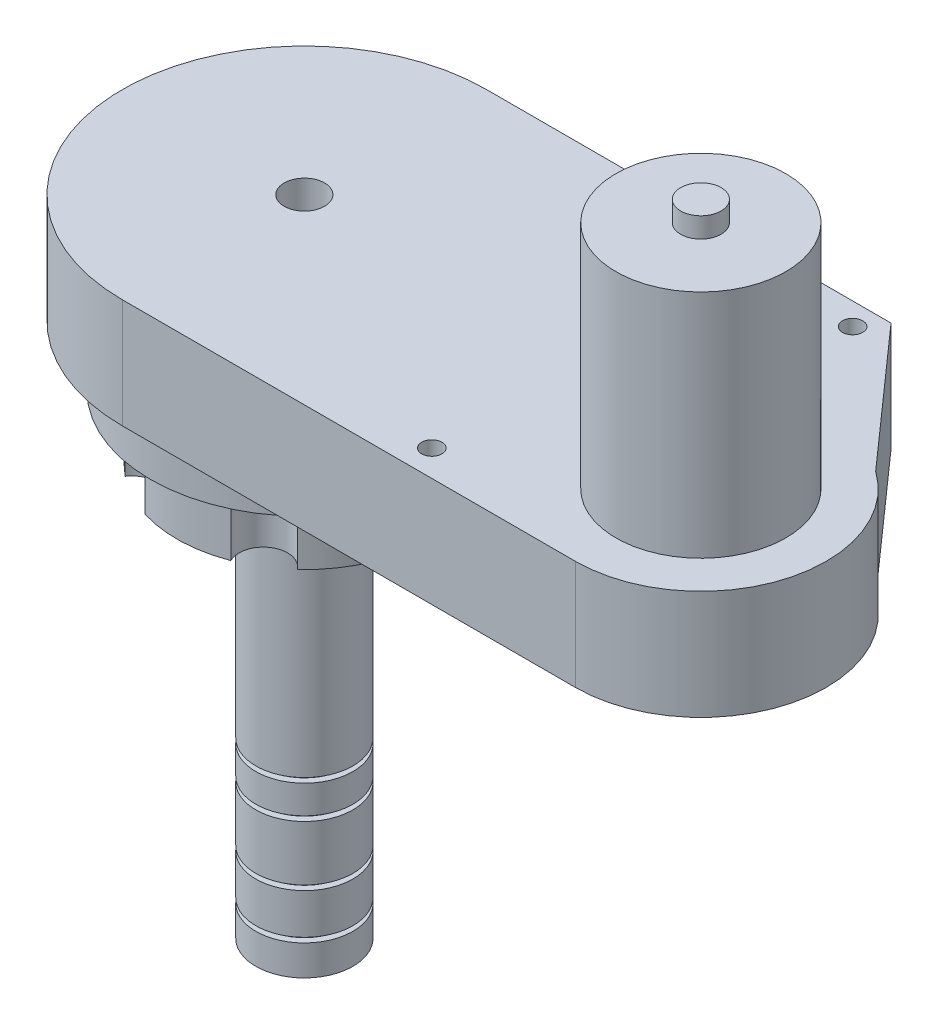
from build123d import *

# Parameters (mm, degrees)
GEAR_START                  = 1.977607415
GEAR_BOX_LEFT_OUTLINE_R     = 2.5
GEAR_BOX_LEFT_OUTLINE_R_2   = 5
GEAR_BOX_LEFT_DEPTH         = 27
GEAR_START_2                = -13.022392585
GEAR_BOX_LEFT_2_OUTLINE_R   = 38
GEAR_BOX_LEFT_2_OUTLINE_R_2 = 5
GEAR_BOX_LEFT_2_DEPTH       = 15
GEAR_START_3                = -29.022392585
GEAR_BOX_LEFT_3_DEPTH       = 16
GEAR_START_4                = 28.977607415
GEAR_BOX_LEFT_4_OUTLINE_R   = 21
GEAR_BOX_LEFT_4_DEPTH       = 57
GEAR_START_5                = 85.977607415
GEAR_BOX_LEFT_5_OUTLINE_R   = 5
GEAR_BOX_LEFT_5_DEPTH       = 5
SKETCH1_R                   = 23.5
BOSS_EXTRUDE1_DEPTH         = 16
SKETCH2_R                   = 12
BOSS_EXTRUDE2_DEPTH         = 101.2
SKETCH3_R                   = 12
SKETCH3_R_2                 = 10.4
CUT_EXTRUDE1_DEPTH          = 1.2
SKETCH4_R                   = 12
SKETCH4_R_2                 = 10.4
CUT_EXTRUDE2_DEPTH          = 1.2
SKETCH7_R                   = 12
SKETCH7_R_2                 = 10.4
CUT_EXTRUDE4_DEPTH          = 1.2
SKETCH8_R                   = 12
SKETCH8_R_2                 = 10.4
CUT_EXTRUDE5_DEPTH          = 1.2
SKETCH26_R                  = 24.974470238
SKETCH26_R_2                = 12
CUT_EXTRUDE16_DEPTH         = 16


# Read off the part's stored shape, not the designer's step: Gear Box_Left
with BuildPart() as part:
    # Gear Box_Left outline → Gear Box_Left (new body)
    with BuildSketch(Plane(origin=(0, 0, 0), x_dir=(1, 0, 0), z_dir=(0, 1, 0)).offset(GEAR_START)):
        with BuildLine():
            Line((-6.41204983, -47.039994013), (105.58795017, -47.039994013))
            ThreePointArc((105.58795017, -47.039994013), (135.138154019, -25.409383135), (123.450360395, 9.296428405))
            Line((123.450360395, 9.296428405), (93.58795017, 42.960005987))
            Line((93.58795017, 42.960005987), (-6.41204983, 42.960005987))
            ThreePointArc((-6.41204983, 42.960005987), (-51.41204983, -2.039994013), (-6.41204983, -47.039994013))
        make_face()
        with Locations((63.58795017, -40.539994013)):
            Circle(GEAR_BOX_LEFT_OUTLINE_R, mode=Mode.SUBTRACT)
        with Locations((89.58795017, 37.460005987)):
            Circle(GEAR_BOX_LEFT_OUTLINE_R, mode=Mode.SUBTRACT)
        with Locations((-6.41204983, -2.039994013)):
            Circle(GEAR_BOX_LEFT_OUTLINE_R_2, mode=Mode.SUBTRACT)
    extrude(amount=GEAR_BOX_LEFT_DEPTH)

    # Gear Box_Left 2 outline → Gear Box_Left 2 (add)
    with BuildSketch(Plane(origin=(0, 0, 0), x_dir=(1, 0, 0), z_dir=(0, 1, 0)).offset(GEAR_START_2)):
        with Locations((-6.41204983, -2.039994013)):
            Circle(GEAR_BOX_LEFT_2_OUTLINE_R)
        with Locations((-6.41204983, -2.039994013)):
            Circle(GEAR_BOX_LEFT_2_OUTLINE_R_2, mode=Mode.SUBTRACT)
    extrude(amount=GEAR_BOX_LEFT_2_DEPTH)

    # Gear Box_Left 3 outline → Gear Box_Left 3 (add)
    with BuildSketch(Plane(origin=(0, 0, 0), x_dir=(1, 0, 0), z_dir=(0, 1, 0)).offset(GEAR_START_3)):
        with BuildLine():
            ThreePointArc((14.98628711, -25.156247521), (21.36455001, -16.896322675), (24.694074697, -7.005778634))
            ThreePointArc((24.694074697, -7.005778634), (19.074516465, -1.21238391), (24.306381418, 4.933382621))
            ThreePointArc((24.306381418, 4.933382621), (20.342208118, 14.587082747), (13.441508065, 22.41580773))
            ThreePointArc((13.441508065, 22.41580773), (5.614501944, 20.445824905), (2.908044478, 28.049636129))
            ThreePointArc((2.908044478, 28.049636129), (-7.434391722, 29.44341141), (-17.664616463, 27.381592351))
            ThreePointArc((-17.664616463, 27.381592351), (-19.872064351, 19.618214802), (-27.81038677, 21.076259494))
            ThreePointArc((-27.81038677, 21.076259494), (-34.18864967, 12.816334649), (-37.518174357, 2.925790607))
            ThreePointArc((-37.518174357, 2.925790607), (-31.898616125, -2.867604117), (-37.130481078, -9.013370648))
            ThreePointArc((-37.130481078, -9.013370648), (-33.166307778, -18.667070774), (-26.265607725, -26.495795757))
            ThreePointArc((-26.265607725, -26.495795757), (-18.438601604, -24.525812932), (-15.732144138, -32.129624156))
            ThreePointArc((-15.732144138, -32.129624156), (-5.389707938, -33.523399437), (4.840516803, -31.461580377))
            ThreePointArc((4.840516803, -31.461580377), (7.047964692, -23.698202829), (14.98628711, -25.156247521))
        make_face()
        with BuildLine():
            ThreePointArc((0.495439231, 26.639904781), (4.671242981, 18.682231264), (13.608258638, 19.6265066))
            ThreePointArc((13.608258638, 19.6265066), (18.643525074, 13.531395335), (21.879215635, 6.317894381))
            ThreePointArc((21.879215635, 6.317894381), (17.075570089, -1.277294507), (22.361844347, -8.544839432))
            ThreePointArc((22.361844347, -8.544839432), (19.60095637, -15.953063713), (14.971726573, -22.362004414))
            ThreePointArc((14.971726573, -22.362004414), (5.992277277, -21.999519784), (2.341535878, -30.211340045))
            ThreePointArc((2.341535878, -30.211340045), (-5.454618534, -31.524453061), (-13.319538891, -30.719892808))
            ThreePointArc((-13.319538891, -30.719892808), (-17.495342641, -22.762219291), (-26.432358298, -23.706494627))
            ThreePointArc((-26.432358298, -23.706494627), (-31.467624734, -17.611383361), (-34.703315295, -10.397882407))
            ThreePointArc((-34.703315295, -10.397882407), (-29.899669749, -2.80269352), (-35.185944007, 4.464851405))
            ThreePointArc((-35.185944007, 4.464851405), (-32.42505603, 11.873075686), (-27.795826233, 18.282016387))
            ThreePointArc((-27.795826233, 18.282016387), (-18.816376938, 17.919531758), (-15.165635538, 26.131352018))
            ThreePointArc((-15.165635538, 26.131352018), (-7.369481126, 27.444465034), (0.495439231, 26.639904781))
        make_face(mode=Mode.SUBTRACT)
    extrude(amount=GEAR_BOX_LEFT_3_DEPTH)


with BuildPart() as body_2:
    # Gear Box_Left 4 outline → Gear Box_Left 4 (new body)
    with BuildSketch(Plane(origin=(0, 0, 0), x_dir=(1, 0, 0), z_dir=(0, 1, 0)).offset(GEAR_START_4)):
        with Locations((105.58795017, -16.039994013)):
            Circle(GEAR_BOX_LEFT_4_OUTLINE_R)
    extrude(amount=GEAR_BOX_LEFT_4_DEPTH)

    # Gear Box_Left 5 outline → Gear Box_Left 5 (add)
    with BuildSketch(Plane(origin=(0, 0, 0), x_dir=(1, 0, 0), z_dir=(0, 1, 0)).offset(GEAR_START_5)):
        with Locations((105.58795017, -16.039994013)):
            Circle(GEAR_BOX_LEFT_5_OUTLINE_R)
    extrude(amount=GEAR_BOX_LEFT_5_DEPTH)


with BuildPart() as body_3:
    # Sketch1 → Boss-Extrude1 (new body)
    with BuildSketch(Plane.XZ.offset(13.022392585)):
        with Locations(Location((-6.41204983, 2.039994013, 0), (0, 0, 270))):
            Circle(SKETCH1_R)
    extrude(amount=BOSS_EXTRUDE1_DEPTH)

    # Sketch26 → Cut-Extrude16 (cut)
    with BuildSketch(Plane(origin=(0, -13.022392585, 0), x_dir=(1, 0, 0), z_dir=(0, 1, 0))):
        with Locations((-6.41204983, -2.039994013)):
            Circle(SKETCH26_R)
        with Locations(Location((-6.41204983, -2.039994013, 0), (0, 0, 90))):
            Circle(SKETCH26_R_2, mode=Mode.SUBTRACT)
    extrude(amount=-CUT_EXTRUDE16_DEPTH, mode=Mode.SUBTRACT)


with BuildPart() as body_4:
    # Sketch2 → Boss-Extrude2 (new body)
    with BuildSketch(Plane.XZ.offset(29.022392585)):
        with Locations(Location((-6.41204983, 2.039994013, 0), (0, 0, 270))):
            Circle(SKETCH2_R)
    extrude(amount=BOSS_EXTRUDE2_DEPTH)

    # Sketch3 → Cut-Extrude1 (cut)
    with BuildSketch(Plane(origin=(0, -88.522392585, 0), x_dir=(-1, 0, 0), z_dir=(0, -1, 0))):
        with Locations(Location((6.41204983, -2.039994013, 0), (0, 0, 90))):
            Circle(SKETCH3_R)
        with Locations(Location((6.41204983, -2.039994013, 0), (0, 0, 90))):
            Circle(SKETCH3_R_2, mode=Mode.SUBTRACT)
    extrude(amount=-CUT_EXTRUDE1_DEPTH, mode=Mode.SUBTRACT)

    # Sketch4 → Cut-Extrude2 (cut)
    with BuildSketch(Plane(origin=(0, -95.522392585, 0), x_dir=(-1, 0, 0), z_dir=(0, -1, 0))):
        with Locations(Location((6.41204983, -2.039994013, 0), (0, 0, 90))):
            Circle(SKETCH4_R)
        with Locations(Location((6.41204983, -2.039994013, 0), (0, 0, 90))):
            Circle(SKETCH4_R_2, mode=Mode.SUBTRACT)
    extrude(amount=CUT_EXTRUDE2_DEPTH, mode=Mode.SUBTRACT)

    # Sketch7 → Cut-Extrude4 (cut)
    with BuildSketch(Plane(origin=(0, -111.522392585, 0), x_dir=(-1, 0, 0), z_dir=(0, -1, 0))):
        with Locations(Location((6.41204983, -2.039994013, 0), (0, 0, 90))):
            Circle(SKETCH7_R)
        with Locations(Location((6.41204983, -2.039994013, 0), (0, 0, 90))):
            Circle(SKETCH7_R_2, mode=Mode.SUBTRACT)
    extrude(amount=-CUT_EXTRUDE4_DEPTH, mode=Mode.SUBTRACT)

    # Sketch8 → Cut-Extrude5 (cut)
    with BuildSketch(Plane(origin=(0, -121.522392585, 0), x_dir=(-1, 0, 0), z_dir=(0, -1, 0))):
        with Locations(Location((6.41204983, -2.039994013, 0), (0, 0, 90))):
            Circle(SKETCH8_R)
        with Locations(Location((6.41204983, -2.039994013, 0), (0, 0, 90))):
            Circle(SKETCH8_R_2, mode=Mode.SUBTRACT)
    extrude(amount=CUT_EXTRUDE5_DEPTH, mode=Mode.SUBTRACT)


solid = Compound([part.part, body_2.part, body_3.part, body_4.part])
